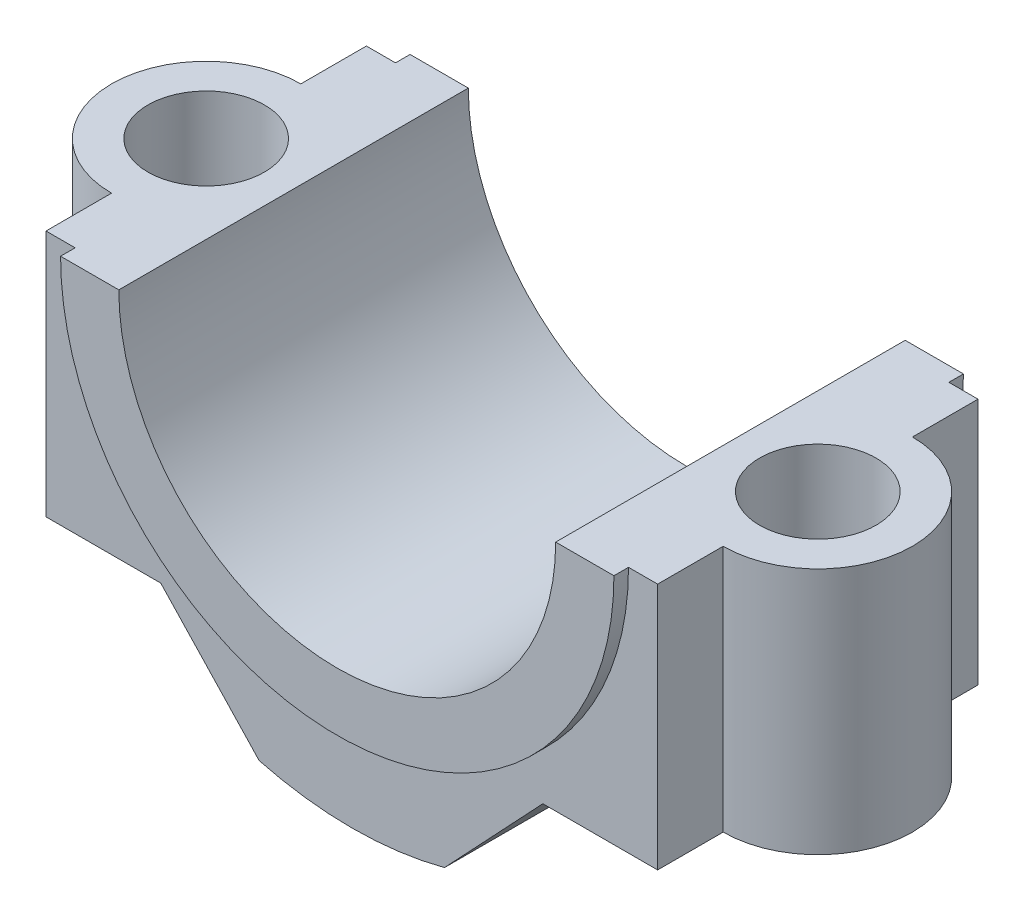
from build123d import *

# Parameters (mm, degrees)
EXTRUDE_2_DEPTH      = 11
EXTRUDE_2_DEPTH_BACK = 11
EXTRUDE_3_DEPTH      = 1
SKETCH_9_R           = 4
CUT_EXTRUDE_5_DEPTH  = 40.05444917
CUT_EXTRUDE_6_DEPTH  = 34.544746235
CHAMFER_1_SIZE       = 5
CHAMFER_2_SIZE       = 5
SKETCH_11_R          = 4
SKETCH_11_W          = 30
SKETCH_11_H          = 22
EXTRUDE_5_DEPTH      = 2


with BuildPart() as part:
    # Эскиз3 → Бобышка-Вытянуть2 (new, two sides: drawn at the far end of the back side and taken through both)
    with BuildSketch(Plane.XY.offset(-EXTRUDE_2_DEPTH_BACK)):
        with BuildLine():
            ThreePointArc((15, 95), (0, 80), (-15, 95))
            Line((-15, 95), (-27.5, 95))
            Line((-27.5, 95), (-27.5, 80))
            Line((-27.5, 80), (-15, 80))
            Line((-15, 80), (-15, 75))
            ThreePointArc((-15, 75), (0, 70), (15, 75))
            Line((15, 75), (15, 80))
            Line((15, 80), (27.5, 80))
            Line((27.5, 80), (27.5, 95))
            Line((27.5, 95), (15, 95))
        make_face()
    extrude(amount=EXTRUDE_2_DEPTH + EXTRUDE_2_DEPTH_BACK)

    # Эскиз5 → Бобышка-Вытянуть3 (add)
    with BuildSketch(Plane.XY.offset(11)):
        with BuildLine():
            Line((-19, 95), (-15, 95))
            ThreePointArc((-15, 95), (0, 80), (15, 95))
            Line((15, 95), (19, 95))
            ThreePointArc((19, 95), (0, 76), (-19, 95))
        make_face()
    extrude_3 = extrude(amount=EXTRUDE_3_DEPTH)

    # Зеркальное отражение1: Бобышка-Вытянуть3 across plane
    add(extrude_3.mirror(Plane.XY))

    # Эскиз9 → Вырез-Вытянуть5 (cut, through all)
    with BuildSketch(Plane(origin=(0, 95, 0), x_dir=(1, 0, 0), z_dir=(0, 1, 0))):
        with Locations(Location((21, 0, 0), (0, 0, 270))):
            Circle(SKETCH_9_R)
        with Locations(Location((-21, 0, 0), (0, 0, 270))):
            Circle(SKETCH_9_R)
    extrude(amount=-CUT_EXTRUDE_5_DEPTH, mode=Mode.SUBTRACT)

    # Эскиз10 → Вырез-Вытянуть6 (cut, through all)
    with BuildSketch(Plane.XZ.offset(-80)):
        with BuildLine():
            Line((27.5, -11), (27.5, 0))
            ThreePointArc((27.5, 0), (25.596194078, -4.596194078), (21, -6.5))
            Line((21, -6.5), (21, -11))
            Line((21, -11), (27.5, -11))
        make_face()
        with BuildLine():
            Line((21, 11), (21, 6.5))
            ThreePointArc((21, 6.5), (25.596194078, 4.596194078), (27.5, 0))
            Line((27.5, 0), (27.5, 11))
            Line((27.5, 11), (21, 11))
        make_face()
    cut_extrude_6 = extrude(amount=-CUT_EXTRUDE_6_DEPTH, mode=Mode.SUBTRACT)

    # Зеркальное отражение2: Вырез-Вытянуть6 across plane
    add(cut_extrude_6.mirror(Plane(origin=(0, 0, 0), x_dir=(0, 0, 1), z_dir=(1, 0, 0))), mode=Mode.SUBTRACT)

    # Фаска1
    # the kernel refuses this chamfer: 20, 5 mm, written as the material it takes off along each edge
    with BuildSketch(Plane(origin=(-15, 75, -36.862227042), x_dir=(0.9002602258420868, -0.4353521858986755, 0), z_dir=(0, 0, 1))) as chamfer_1_piece_1_section:
        with BuildLine():
            Line((9.593719339, 0), (-CHAMFER_1_SIZE * 0.435352185899, CHAMFER_1_SIZE * 0.900260225842))
            Line((-CHAMFER_1_SIZE * 0.435352185899, CHAMFER_1_SIZE * 0.900260225842), (0, 0))
            ThreePointArc((0, 0), (5.175297631, -0.461648225), (9.593719339, 0))
        make_face()
    chamfer_1_piece_1 = extrude(amount=73.724454084, mode=Mode.PRIVATE)
    chamfer_1_piece_1 = split(chamfer_1_piece_1, bisect_by=Plane(origin=(-15, 80, -36.862227042), z_dir=(0, -1, 0)), keep=Keep.TOP, mode=Mode.PRIVATE)
    add(chamfer_1_piece_1, mode=Mode.SUBTRACT)

    # Фаска2
    # the kernel refuses this chamfer: 20, 5 mm, written as the material it takes off along each edge
    with BuildSketch(Plane(origin=(15, 75, -36.862227042), x_dir=(-0.9002602258420859, -0.43535218589867725, 0), z_dir=(0, 0, 1))) as chamfer_2_piece_1:
        with BuildLine():
            Line((9.593719339, 0), (-CHAMFER_2_SIZE * 0.435352185899, -CHAMFER_2_SIZE * 0.900260225842))
            Line((-CHAMFER_2_SIZE * 0.435352185899, -CHAMFER_2_SIZE * 0.900260225842), (0, 0))
            ThreePointArc((0, 0), (5.175297631, 0.461648225), (9.593719339, 0))
        make_face()
    extrude(amount=73.724454084, mode=Mode.SUBTRACT)

    # Эскиз11 → Бобышка-Вытянуть5 (add)
    # profile 1 of 3: a face of its own
    with BuildSketch(Plane.XZ.offset(-80)):
        with BuildLine():
            Line((-15, 11), (-21, 11))
            Line((-21, 11), (-21, 6.5))
            ThreePointArc((-21, 6.5), (-27.5, 0), (-21, -6.5))
            Line((-21, -6.5), (-21, -11))
            Line((-21, -11), (-15, -11))
            Line((-15, -11), (-15, 11))
        make_face()
        with Locations(Location((-21, 0, 0), (0, 0, 90))):
            Circle(SKETCH_11_R, mode=Mode.SUBTRACT)
    # profile 2 of 3: a face of its own
    with BuildSketch(Plane.XZ.offset(-80)):
        with BuildLine():
            Line((21, -11), (21, -6.5))
            ThreePointArc((21, -6.5), (27.5, 0), (21, 6.5))
            Line((21, 6.5), (21, 11))
            Line((21, 11), (15, 11))
            Line((15, 11), (15, -11))
            Line((15, -11), (21, -11))
        make_face()
        with Locations(Location((21, 0, 0), (0, 0, 90))):
            Circle(SKETCH_11_R, mode=Mode.SUBTRACT)
    # profile 3 of 3: a face of its own
    with BuildSketch(Plane.XZ.offset(-80)):
        Rectangle(SKETCH_11_W, SKETCH_11_H)
    extrude(amount=EXTRUDE_5_DEPTH)


solid = part.part
